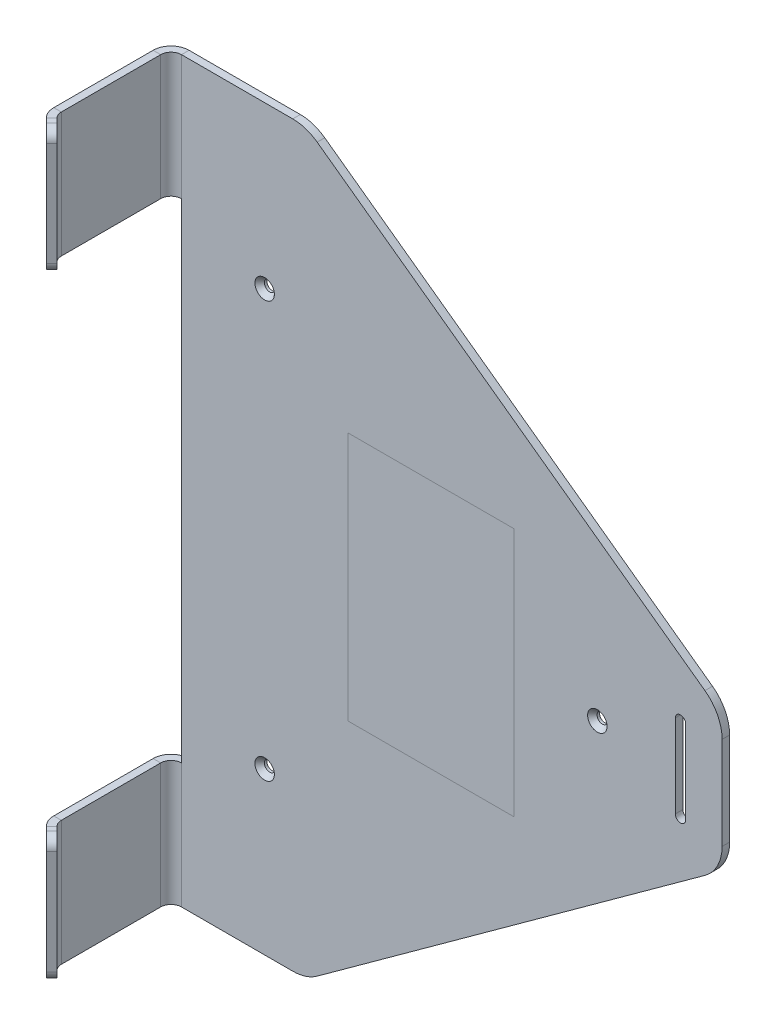
from build123d import *

# Parameters (mm, degrees)
BASE_FLANGE1_DEPTH                    = 2.3114
EDGE_FLANGE2_DEPTH                    = 38.1
EDGE_FLANGE3_START                    = -112.7125
EDGE_FLANGE3_DEPTH                    = 38.1
EDGE_FLANGE3_2_DEPTH                  = 38.1
CUT_EXTRUDE1_DEPTH                    = 149.767894723
CUT_EXTRUDE1_DEPTH_BACK               = 149.767894723
BREAK_CORNER1_START                   = -89.191903794
BREAK_CORNER1_DEPTH                   = 2.3114
BREAK_CORNER2_DEPTH                   = 2.3114
F_30_0_1285_DIAMETER_HOLE1_AT_2_COUNT = 2
F_30_0_1285_DIAMETER_HOLE1_AT_2_PITCH = 127
F_30_0_1285_DIAMETER_HOLE1_AT_3_COUNT = 2
F_30_0_1285_DIAMETER_HOLE1_AT_3_PITCH = 119.811560377


# Read off the part's stored shape, not the designer's step: Edge-Flange3, Break-Corner1, Break-Corner2
# Sheet-metal steps are written as plain solids
with BuildPart() as part:
    # Sketch1 → Base-Flange1 (new body)
    with BuildSketch(Plane.XY):
        Polygon((-82.55, 112.7125), (-82.55, -112.7125), (-44.45, -112.7125), (82.55, -20.6375), (82.55, 20.6375), (-44.45, 112.7125), align=None)
    extrude(amount=BASE_FLANGE1_DEPTH)

    # Edge-Flange2 section (across the edge) → Edge-Flange2 (add)
    with BuildSketch(Plane(origin=(-85.725, -74.6125, 2.3114), x_dir=(1, 0, 0), z_dir=(0, -1, 0))):
        with BuildLine():
            Line((-2.3114, 3.175), (-2.3114, 38.1))
            Line((-2.3114, 38.1), (0, 38.1))
            Line((0, 38.1), (0, 3.175))
            ThreePointArc((0, 3.175), (0.92993597, 0.92993597), (3.175, 0))
            Line((3.175, 0), (3.175, -2.3114))
            ThreePointArc((3.175, -2.3114), (-0.704470644, -0.704470644), (-2.3114, 3.175))
        make_face()
    edge_flange2 = extrude(amount=EDGE_FLANGE2_DEPTH)

    # Mirror1: Edge-Flange2 across plane
    add(edge_flange2.mirror(Plane.ZX))

    # Edge-Flange3 outline → Edge-Flange3 (cut)
    with BuildSketch(Plane(origin=(0, 0, 0), x_dir=(1, 0, 0), z_dir=(0, 1, 0)).offset(EDGE_FLANGE3_START)):
        with BuildLine():
            Line((-85.725, -40.4114), (-86.429470644, -39.706929356))
            ThreePointArc((-86.429470644, -39.706929356), (-87.618772667, -37.927013095), (-88.0364, -35.827458711))
            Line((-88.0364, -35.827458711), (-88.0364, -40.4114))
            Line((-88.0364, -40.4114), (-85.725, -40.4114))
        make_face()
    edge_flange3 = extrude(amount=EDGE_FLANGE3_DEPTH, mode=Mode.SUBTRACT)

    # Edge-Flange3 2 outline → Edge-Flange3 2 (add)
    with BuildSketch(Plane(origin=(0, 0, 0), x_dir=(1, 0, 0), z_dir=(0, 1, 0)).offset(EDGE_FLANGE3_START)):
        with BuildLine():
            Line((-85.725, -35.827458711), (-85.725, -40.4114))
            Line((-85.725, -40.4114), (-82.869278554, -43.267121446))
            Line((-82.869278554, -43.267121446), (-81.234871939, -41.632714832))
            Line((-81.234871939, -41.632714832), (-84.79506403, -38.072522742))
            ThreePointArc((-84.79506403, -38.072522742), (-85.483317516, -37.042478609), (-85.725, -35.827458711))
        make_face()
    edge_flange3_2 = extrude(amount=EDGE_FLANGE3_2_DEPTH)

    # Mirror2: Edge-Flange3, Edge-Flange3 2 across plane
    add(edge_flange3.mirror(Plane.ZX), mode=Mode.SUBTRACT)
    add(edge_flange3_2.mirror(Plane.ZX))

    # Sketch15 → Cut-Extrude1 (cut, two sides: drawn at the far end of the back side and taken through both)
    with BuildSketch(Plane.XY.offset(2.3114).offset(-CUT_EXTRUDE1_DEPTH_BACK)):
        with BuildLine():
            Line((71.4375, 12.7), (71.4375, -12.7))
            ThreePointArc((71.4375, -12.7), (69.85, -14.2875), (68.2625, -12.7))
            Line((68.2625, -12.7), (68.2625, 12.7))
            ThreePointArc((68.2625, 12.7), (69.85, 14.2875), (71.4375, 12.7))
        make_face()
    extrude(amount=CUT_EXTRUDE1_DEPTH + CUT_EXTRUDE1_DEPTH_BACK, mode=Mode.SUBTRACT)

    # Break-Corner1 outline → Break-Corner1 (cut)
    with BuildSketch(Plane(origin=(0, 0, 0), x_dir=(0.707106781186541, 0, 0.707106781186554), z_dir=(0.707106781186554, 0, -0.707106781186541)).offset(BREAK_CORNER1_START)):
        with BuildLine():
            Line((-28.00295384, 74.6125), (-28.00295384, 77.7875))
            ThreePointArc((-28.00295384, 77.7875), (-28.93288981, 75.54243597), (-31.17795384, 74.6125))
            Line((-31.17795384, 74.6125), (-28.00295384, 74.6125))
        make_face()
        with BuildLine():
            ThreePointArc((-31.17795384, 112.7125), (-28.93288981, 111.78256403), (-28.00295384, 109.5375))
            Line((-28.00295384, 109.5375), (-28.00295384, 112.7125))
            Line((-28.00295384, 112.7125), (-31.17795384, 112.7125))
        make_face()
        with BuildLine():
            ThreePointArc((-31.17795384, -74.6125), (-28.93288981, -75.54243597), (-28.00295384, -77.7875))
            Line((-28.00295384, -77.7875), (-28.00295384, -74.6125))
            Line((-28.00295384, -74.6125), (-31.17795384, -74.6125))
        make_face()
        with BuildLine():
            ThreePointArc((-28.00295384, -109.5375), (-28.93288981, -111.78256403), (-31.17795384, -112.7125))
            Line((-31.17795384, -112.7125), (-28.00295384, -112.7125))
            Line((-28.00295384, -112.7125), (-28.00295384, -109.5375))
        make_face()
    extrude(amount=BREAK_CORNER1_DEPTH, mode=Mode.SUBTRACT)

    # Break-Corner2 outline → Break-Corner2 (cut)
    with BuildSketch(Plane.XY):
        with BuildLine():
            Line((-44.45, 112.7125), (-48.569388338, 112.7125))
            ThreePointArc((-48.569388338, 112.7125), (-44.650974655, 112.09289876), (-41.114900181, 110.294552631))
            Line((-41.114900181, 110.294552631), (-44.45, 112.7125))
        make_face()
        with BuildLine():
            Line((-44.45, -112.7125), (-41.114900181, -110.294552631))
            ThreePointArc((-41.114900181, -110.294552631), (-44.650974655, -112.09289876), (-48.569388338, -112.7125))
            Line((-48.569388338, -112.7125), (-44.45, -112.7125))
        make_face()
        with BuildLine():
            Line((82.55, -20.6375), (82.55, -14.158443455))
            ThreePointArc((82.55, -14.158443455), (81.16286877, -19.929838451), (77.304488158, -24.440496086))
            Line((77.304488158, -24.440496086), (82.55, -20.6375))
        make_face()
        with BuildLine():
            Line((82.55, 20.6375), (77.304488158, 24.440496086))
            ThreePointArc((77.304488158, 24.440496086), (81.16286877, 19.929838451), (82.55, 14.158443455))
            Line((82.55, 14.158443455), (82.55, 20.6375))
        make_face()
    extrude(amount=BREAK_CORNER2_DEPTH, mode=Mode.SUBTRACT)

    # Sketch18 → #30 (0.1285) Diameter Hole1 (revolve, cut)
    with BuildSketch(Plane(origin=(-57.15, -63.5, 2.3114), x_dir=(0, -1, 0), z_dir=(1, 0, 0))):
        Polygon((0, 0), (0, 2.3114), (1.63195, 2.3114), (1.63195, 1.54132111), (2.9718, 0), align=None)
    f_30_0_1285_diameter_hole1 = revolve(axis=Axis((-57.15, -63.5, 8.6614), (0, 0, -1)), mode=Mode.SUBTRACT)

    # #30 (0.1285) Diameter Hole1 at 2: #30 (0.1285) Diameter Hole1 ×2
    with Locations(*[(0, i * F_30_0_1285_DIAMETER_HOLE1_AT_2_PITCH, 0) for i in range(1, F_30_0_1285_DIAMETER_HOLE1_AT_2_COUNT)]):
        add(f_30_0_1285_diameter_hole1, mode=Mode.SUBTRACT)

    # #30 (0.1285) Diameter Hole1 at 3: #30 (0.1285) Diameter Hole1 ×2
    with Locations(*[Vector(0.8479983040050879, 0.52999894000318, 0) * (i * F_30_0_1285_DIAMETER_HOLE1_AT_3_PITCH) for i in range(1, F_30_0_1285_DIAMETER_HOLE1_AT_3_COUNT)]):
        add(f_30_0_1285_diameter_hole1, mode=Mode.SUBTRACT)


solid = part.part
